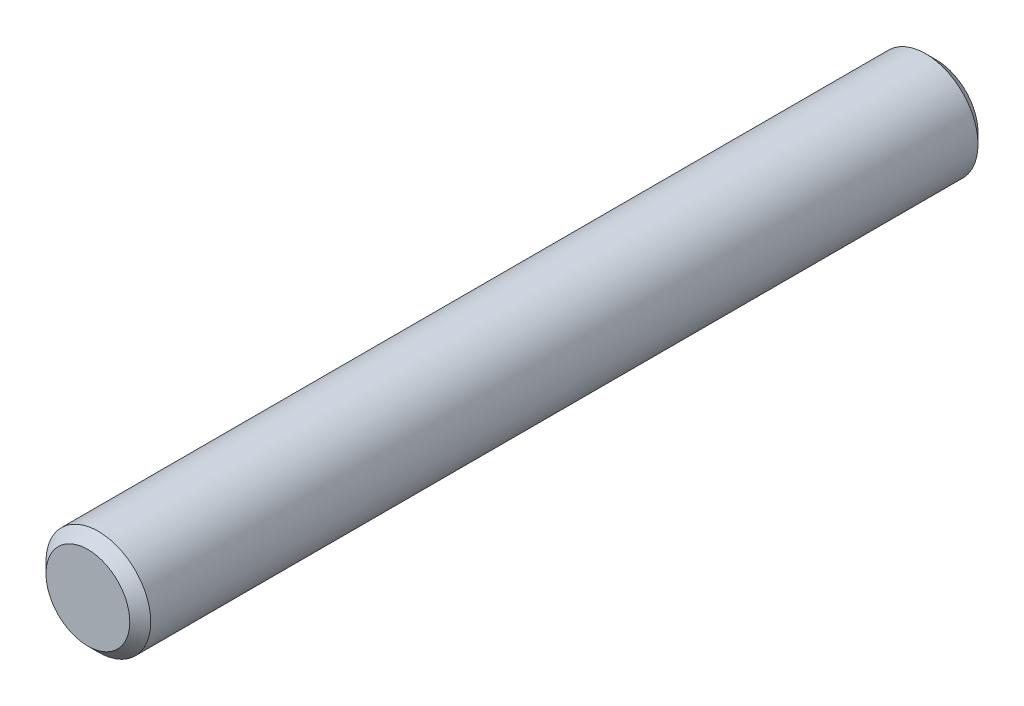
from build123d import *

# Parameters (mm, degrees)
SKETCH1_R      = 6.35
EXTRUDE1_DEPTH = 51.435
CHAMFER1_SIZE  = 1.27


with BuildPart() as part:
    # Sketch1 → Extrude1 (new, symmetric)
    with BuildSketch(Plane.XY):
        Circle(SKETCH1_R)
    extrude(amount=EXTRUDE1_DEPTH, both=True)

    # Chamfer1
    chamfer1_edges = [part.edges().sort_by_distance(p)[0] for p in [
        (-6.35, 0, -51.435),
        (-6.35, 0, 51.435),
    ]]
    chamfer(chamfer1_edges, length=CHAMFER1_SIZE)


solid = part.part
